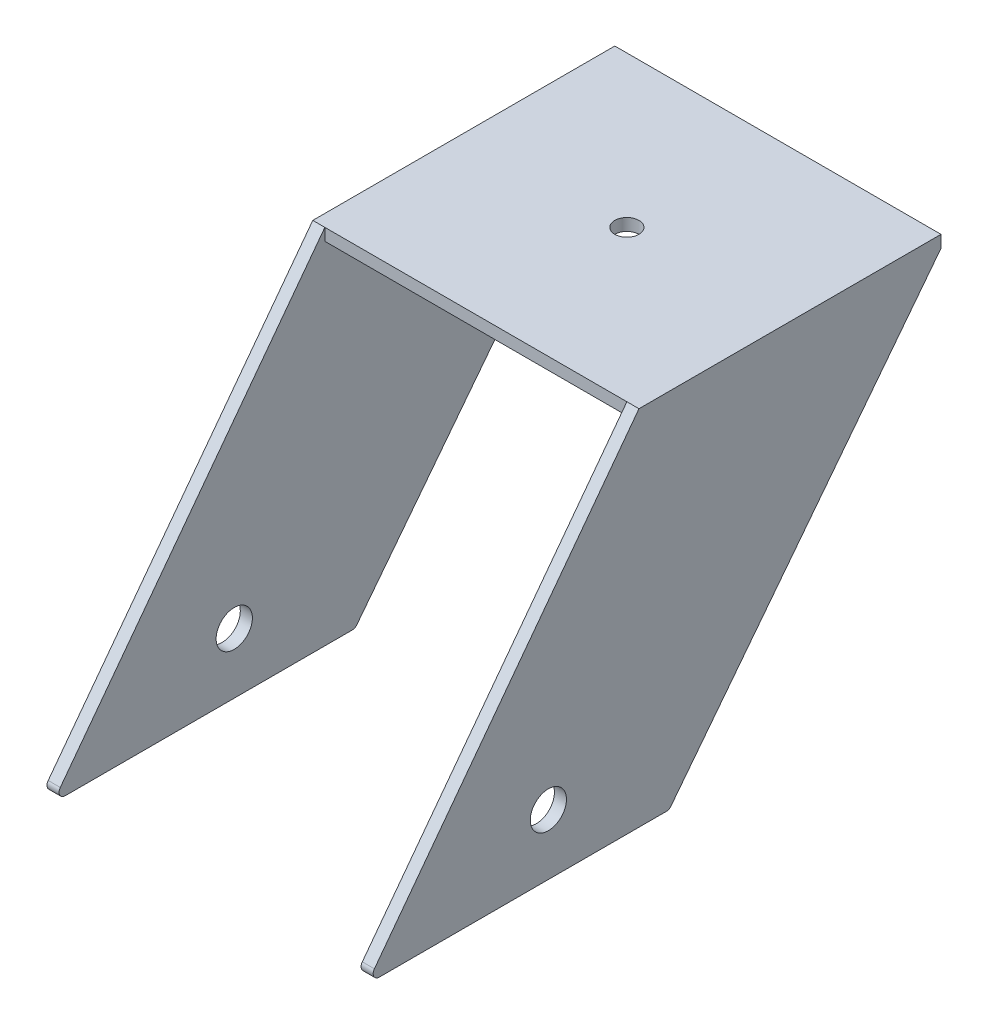
from build123d import *

# Parameters (mm, degrees)
SKETCH2_W           = 50
SKETCH2_H           = 50
SKETCH2_R           = 2
BOSS_EXTRUDE1_DEPTH = 2
SKETCH4_R           = 3
BOSS_EXTRUDE2_DEPTH = 2
BOSS_EXTRUDE3_START = 2
SKETCH3_R           = 3
BOSS_EXTRUDE3_DEPTH = 2
FILLET1_R           = 1
FILLET2_R           = 1


with BuildPart() as part:
    # Sketch2 → Boss-Extrude1 (new body)
    with BuildSketch(Plane(origin=(0, 0, 0), x_dir=(1, 0, 0), z_dir=(0, 1, 0))):
        Rectangle(SKETCH2_W, SKETCH2_H)
        Circle(SKETCH2_R, mode=Mode.SUBTRACT)
    extrude(amount=BOSS_EXTRUDE1_DEPTH)

    # Sketch4 → Boss-Extrude2 (add)
    with BuildSketch(Plane.ZY.offset(25)):
        Polygon((25, 2), (-25, 2), (-25, 0.026324244), (20, -58), (70, -58), align=None)
        with Locations((40, -48)):
            Circle(SKETCH4_R, mode=Mode.SUBTRACT)
    extrude(amount=BOSS_EXTRUDE2_DEPTH)

    # Sketch3 → Boss-Extrude3 (add)
    with BuildSketch(Plane(origin=(25, 0, 0), x_dir=(0, 0, -1), z_dir=(1, 0, 0)).offset(BOSS_EXTRUDE3_START)):
        Polygon((-25, 2), (-70, -58), (-20, -58), (25, 0), (25, 2), align=None)
        with Locations((-40, -48)):
            Circle(SKETCH3_R, mode=Mode.SUBTRACT)
    extrude(amount=-BOSS_EXTRUDE3_DEPTH)

    # Fillet1
    fillet1_edges = [part.edges().sort_by_distance(p)[0] for p in [
        (26, -58, 20),
        (-26, -58, 20),
    ]]
    fillet(fillet1_edges, radius=FILLET1_R)

    # Fillet2
    fillet2_edges = [part.edges().sort_by_distance(p)[0] for p in [
        (26, -58, 70),
        (-26, -58, 70),
    ]]
    fillet(fillet2_edges, radius=FILLET2_R)


solid = part.part
